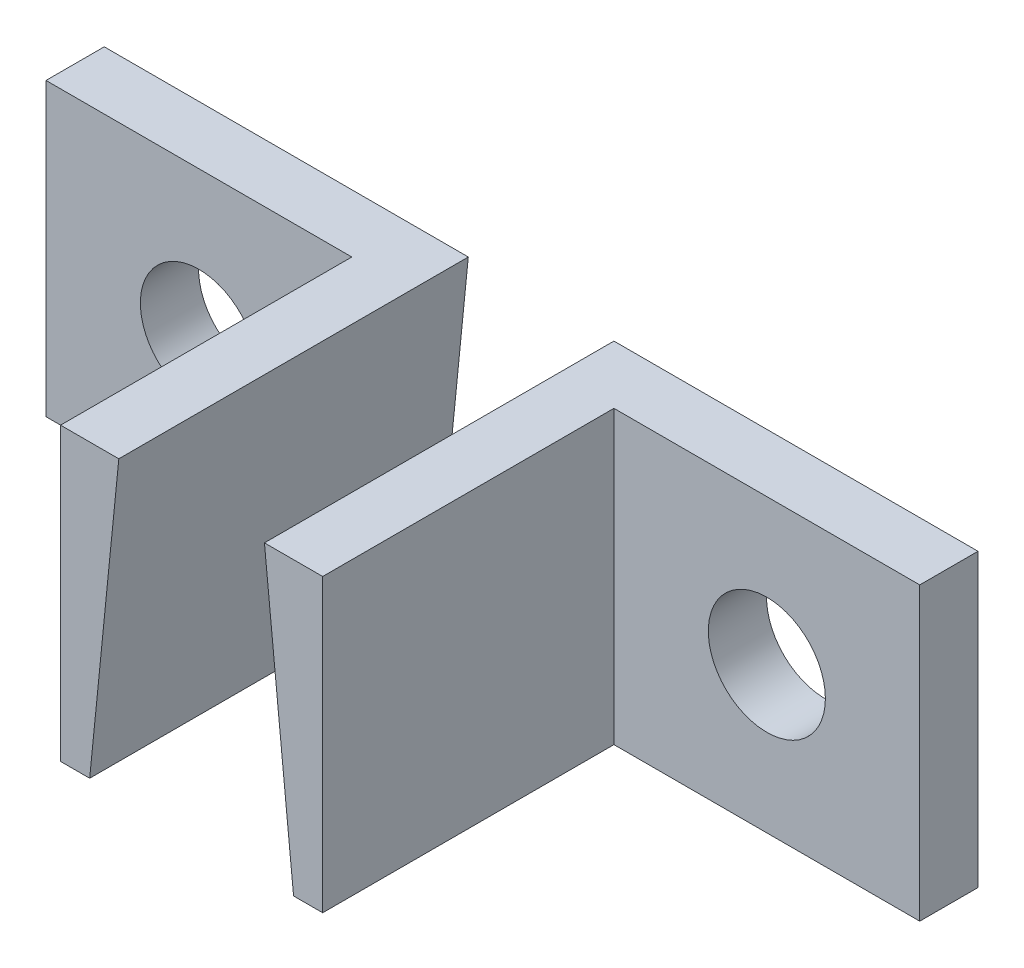
from build123d import *

# Parameters (mm, degrees)
SKETCH1_W                      = 38.1
SKETCH1_H                      = 12.7
BOSS_EXTRUDE1_DEPTH            = 2.54
SKETCH2_W                      = 2.54
SKETCH2_H                      = 12.7
BOSS_EXTRUDE2_DEPTH            = 12.7
SKETCH3_W                      = 6.35
SKETCH3_H                      = 12.7
CUT_EXTRUDE1_DEPTH             = 43.121134838
CUT_EXTRUDE2_DEPTH             = 43.955297694
F_10_CLEARANCE_HOLE1_OUTLINE_R = 2.5527
F_10_CLEARANCE_HOLE1_DEPTH     = 2.54


# Read off the part's stored shape, not the designer's step: #10 Clearance Hole1
with BuildPart() as part:
    # Sketch1 → Boss-Extrude1 (new body)
    with BuildSketch(Plane.XY):
        with Locations((-19.05, 6.35)):
            Rectangle(SKETCH1_W, SKETCH1_H)
    extrude(amount=BOSS_EXTRUDE1_DEPTH)

    # Sketch2 → Boss-Extrude2 (add)
    with BuildSketch(Plane(origin=(-38.1, 12.7, 2.54), x_dir=(-1, 0, 0), z_dir=(0, 0, -1))):
        with Locations((-14.605, -6.35)):
            Rectangle(SKETCH2_W, SKETCH2_H)
        with Locations((-23.495, -6.35)):
            Rectangle(SKETCH2_W, SKETCH2_H)
    extrude(amount=-BOSS_EXTRUDE2_DEPTH)

    # Sketch3 → Cut-Extrude1 (cut, through all)
    with BuildSketch(Plane.XY.offset(2.54)):
        with Locations((-19.05, 6.35)):
            Rectangle(SKETCH3_W, SKETCH3_H)
    extrude(amount=-CUT_EXTRUDE1_DEPTH, mode=Mode.SUBTRACT)


with BuildPart() as cut_extrude1_piece_1:
    # of the separate pieces the step leaves, piece 1, a body of its own (cut_extrude1_pieces)
    add(part.part.solids().sort_by_distance((-22.225, 0, 0))[0])


with BuildPart() as cut_extrude1_piece_2:
    # of the separate pieces the step leaves, piece 2, a body of its own (cut_extrude1_pieces)
    add(part.part.solids().sort_by_distance((0, 0, 0))[0])


with BuildPart() as cut_extrude2_tool:
    # Sketch4 → Cut-Extrude2 (new, through all)
    with BuildSketch(Plane.XY.offset(15.24)):
        Polygon((-22.225, 12.7), (-23.495, 0), (-22.225, 0), align=None)
        Polygon((-15.875, 12.7), (-14.605, 0), (-15.875, 0), align=None)
    extrude(amount=-CUT_EXTRUDE2_DEPTH)


with BuildPart() as cut_extrude1_piece_1_1:
    add(cut_extrude1_piece_1.part)

    # Cut-Extrude2: cut by cut_extrude2_tool
    add(cut_extrude2_tool.part, mode=Mode.SUBTRACT)


with BuildPart() as cut_extrude1_piece_2_1:
    add(cut_extrude1_piece_2.part)

    # Cut-Extrude2: cut by cut_extrude2_tool
    add(cut_extrude2_tool.part, mode=Mode.SUBTRACT)


with BuildPart() as f_10_clearance_hole1_tool:
    # #10 Clearance Hole1 outline → #10 Clearance Hole1 (new body)
    with BuildSketch(Plane.XY):
        with Locations((-31.4325, 6.35)):
            Circle(F_10_CLEARANCE_HOLE1_OUTLINE_R)
        with Locations((-6.6675, 6.35)):
            Circle(F_10_CLEARANCE_HOLE1_OUTLINE_R)
    extrude(amount=F_10_CLEARANCE_HOLE1_DEPTH)


with BuildPart() as cut_extrude1_piece_1_2:
    add(cut_extrude1_piece_1_1.part)

    # #10 Clearance Hole1: cut by f_10_clearance_hole1_tool
    add(f_10_clearance_hole1_tool.part, mode=Mode.SUBTRACT)


with BuildPart() as cut_extrude1_piece_2_2:
    add(cut_extrude1_piece_2_1.part)

    # #10 Clearance Hole1: cut by f_10_clearance_hole1_tool
    add(f_10_clearance_hole1_tool.part, mode=Mode.SUBTRACT)


solid = Compound([cut_extrude1_piece_1_2.part, cut_extrude1_piece_2_2.part])
